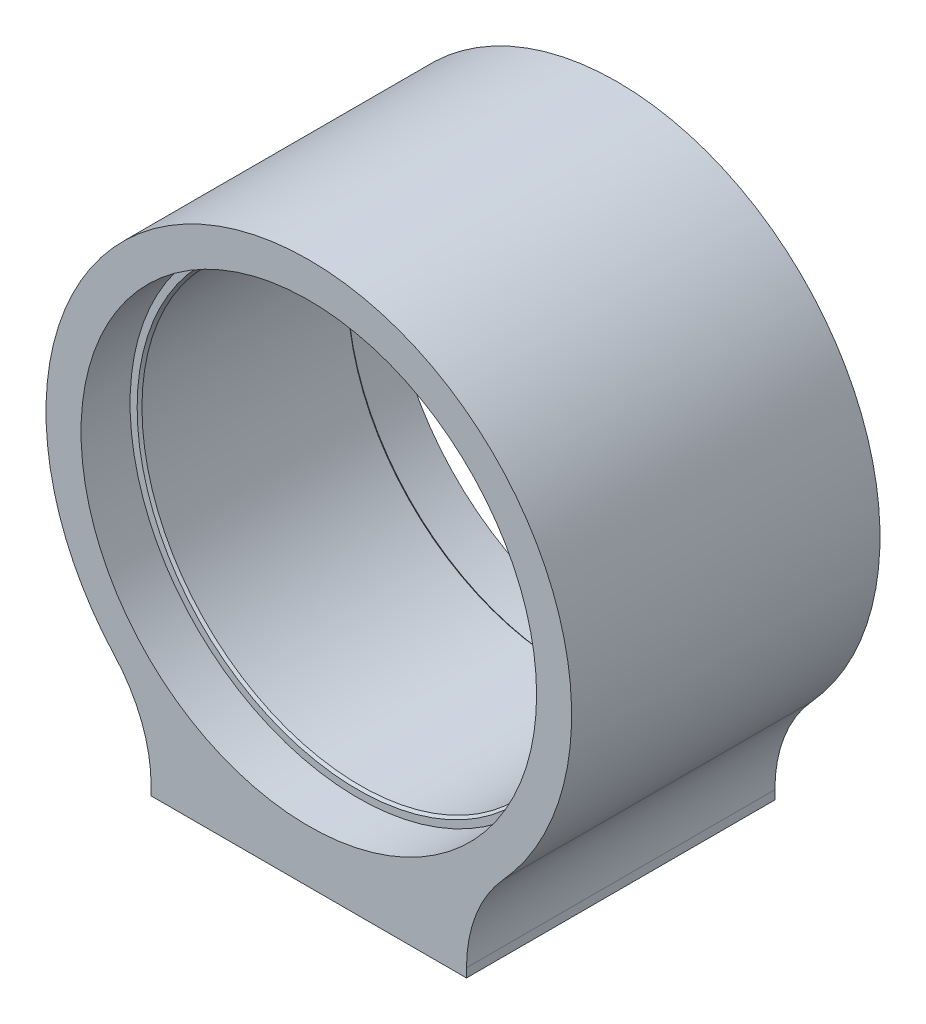
from build123d import *

# Parameters (mm, degrees)
EXTRUSION1_DEPTH              = 15
EXTRUSION1_DEPTH_BACK         = 15
SKETCH1_R                     = 37.5
SKETCH1_R_2                   = 31.15
HOLE4_D                       = 2.5
HOLE4_DEPTH                   = 8
HOLE4_TIP                     = 1.25
SKETCH5_R                     = 37.5
SKETCH5_R_2                   = 32.5
EXTRUSION11_DEPTH             = 7
EXTRUSION17_START             = 7
SKETCH6_R                     = 37.5
SKETCH6_R_2                   = 32.5
EXTRUSION17_DEPTH             = 7
EXTRUSION18_REACH             = 59.415
EXTRUSION18_DIRECTION_2_REACH = 59.415
FILLET5_R                     = 20
HOLE6_D                       = 2.5
HOLE6_DEPTH                   = 8
HOLE6_TIP                     = 0.751075774


with BuildPart() as part:
    # Sketch1 → Extrusion1 (new, two sides: drawn at the far end of the back side and taken through both)
    with BuildSketch(Plane.XY.offset(-EXTRUSION1_DEPTH_BACK)):
        Circle(SKETCH1_R)
        Circle(SKETCH1_R_2, mode=Mode.SUBTRACT)
    extrude(amount=EXTRUSION1_DEPTH + EXTRUSION1_DEPTH_BACK)

    # Hole4
    with Locations(Plane.XY.offset(15)):
        with Locations((35, 0), (13.862791811, 32.137563741), (-24.018457325, 25.458077455), (-32.889241728, -11.970705016), (-2.035069012, -34.940785539), (31.277142411, -15.707971307)):
            Hole(HOLE4_D / 2, depth=HOLE4_DEPTH)
            with Locations((0, 0, -(HOLE4_DEPTH + HOLE4_TIP / 2))):  # 90° drill point
                Cone(0, HOLE4_D / 2, HOLE4_TIP, mode=Mode.SUBTRACT)

    # Sketch5 → Extrusion11 (add)
    with BuildSketch(Plane(origin=(0, 0, -15), x_dir=(-1, 0, 0), z_dir=(0, 0, -1))):
        Circle(SKETCH5_R)
        Circle(SKETCH5_R_2, mode=Mode.SUBTRACT)
    extrude(amount=EXTRUSION11_DEPTH)

    # Sketch6 → Extrusion17 (add)
    with BuildSketch(Plane.XY.offset(15).offset(EXTRUSION17_START)):
        Circle(SKETCH6_R)
        Circle(SKETCH6_R_2, mode=Mode.SUBTRACT)
    extrude(amount=-EXTRUSION17_DEPTH)

    # Extrusion18: up to this face of the body (flat: up to its plane)
    extrusion18_end = Plane(part.part.faces().sort_by_distance((-36.439339828, 0, 22))[0])
    # Sketch7 → Extrusion18 (add, up to the picked face)
    with BuildSketch(Plane.XY, mode=Mode.PRIVATE) as extrusion18_sk1:
        with BuildLine():
            Line((22.5, -40), (-22.5, -40))
            Line((-22.5, -40), (-22.5, -30))
            ThreePointArc((-22.5, -30), (0, -37.5), (22.5, -30))
            Line((22.5, -30), (22.5, -40))
        make_face()
    extrusion18_tool1 = split(extrude(extrusion18_sk1.sketch, amount=EXTRUSION18_REACH, mode=Mode.PRIVATE), bisect_by=extrusion18_end, keep=Keep.BOTH, mode=Mode.PRIVATE)
    add(extrusion18_tool1.solids().sort_by(Axis((22.039023, -35, 0), (0, 0, 1)))[0])

    # Extrusion18 direction 2: up to this face of the body (flat: up to its plane)
    extrusion18_direction_2_end = Plane(part.part.faces().sort_by_distance((36.439339828, 0, -22))[0])
    # Sketch7 → Extrusion18 direction 2 (add, up to the picked face)
    with BuildSketch(Plane.XY, mode=Mode.PRIVATE) as extrusion18_direction_2_sk1:
        with BuildLine():
            Line((22.5, -40), (-22.5, -40))
            Line((-22.5, -40), (-22.5, -30))
            ThreePointArc((-22.5, -30), (0, -37.5), (22.5, -30))
            Line((22.5, -30), (22.5, -40))
        make_face()
    extrusion18_direction_2_tool1 = split(extrude(extrusion18_direction_2_sk1.sketch, amount=-EXTRUSION18_DIRECTION_2_REACH, mode=Mode.PRIVATE), bisect_by=extrusion18_direction_2_end, keep=Keep.BOTH, mode=Mode.PRIVATE)
    add(extrusion18_direction_2_tool1.solids().sort_by(Axis((22.039023, -35, 0), (0, 0, -1)))[0])

    # Fillet5
    fillet5_edges = [part.edges().sort_by_distance(p)[0] for p in [
        (22.5, -30, 0),
        (-22.5, -30, 0),
    ]]
    fillet(fillet5_edges, radius=FILLET5_R)

    # Sketch8 → Revolution1 (revolve, cut)
    with BuildSketch(Plane.YZ):
        Polygon((31.493036454, 15), (30.493036454, 15), (30.493036454, 14), align=None)
    revolution1 = revolve(axis=Axis((0, 0, 0), (0, 0, 1)), mode=Mode.SUBTRACT)

    # Mirror1: Revolution1 across plane
    add(revolution1.mirror(Plane.XY), mode=Mode.SUBTRACT)

    # Hole6
    with Locations(Plane(origin=(0, -40, 0), x_dir=(-1, 0, 0), z_dir=(0, -1, 0))):
        with Locations((-17.5, -17.5), (-17.5, 17.5), (17.5, -17.5), (17.5, 17.5)):
            Hole(HOLE6_D / 2, depth=HOLE6_DEPTH)
            with Locations((0, 0, -(HOLE6_DEPTH + HOLE6_TIP / 2))):  # 118° drill point
                Cone(0, HOLE6_D / 2, HOLE6_TIP, mode=Mode.SUBTRACT)


solid = part.part
